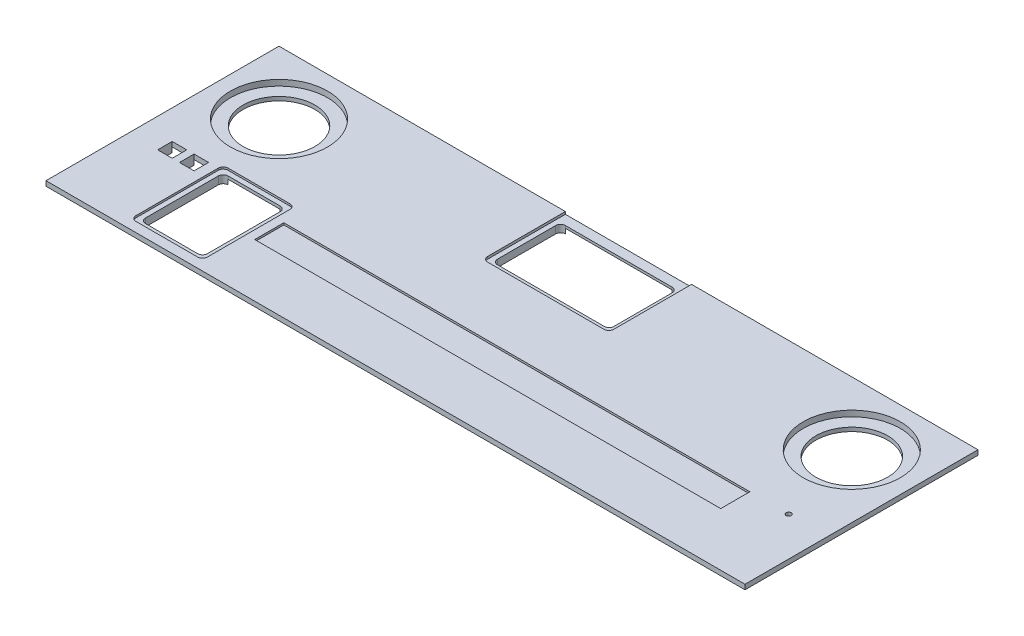
from build123d import *

# Parameters (mm, degrees)
SKETCH1_W           = 914.4
SKETCH1_H           = 304.8
BOSS_EXTRUDE1_DEPTH = 12.7
SKETCH5_W           = 609.6
SKETCH5_H           = 38.1
CUT_EXTRUDE3_DEPTH  = 2.54
SKETCH6_R           = 46.99
CUT_EXTRUDE4_DEPTH  = 964.945895785
SKETCH7_R           = 63.5
CUT_EXTRUDE5_DEPTH  = 7.62
CUT_EXTRUDE6_DEPTH  = 964.945895785
CUT_EXTRUDE7_DEPTH  = 3.175
SKETCH13_W          = 19.05
SKETCH13_H          = 19.05
CUT_EXTRUDE11_DEPTH = 964.945895785
CUT_EXTRUDE19_DEPTH = 964.945895785
CUT_EXTRUDE20_DEPTH = 2.54
SKETCH26_R          = 3.302
CUT_EXTRUDE21_DEPTH = 964.945895785
SKETCH19_W          = 914.4
SKETCH19_H          = 304.8
CUT_EXTRUDE16_DEPTH = 6.35


with BuildPart() as part:
    # Sketch1 → Boss-Extrude1 (new body)
    with BuildSketch(Plane(origin=(0, 0, 0), x_dir=(1, 0, 0), z_dir=(0, 1, 0))):
        with Locations((457.2, 152.4)):
            Rectangle(SKETCH1_W, SKETCH1_H)
    extrude(amount=BOSS_EXTRUDE1_DEPTH)

    # Sketch5 → Cut-Extrude3 (cut)
    with BuildSketch(Plane(origin=(0, 12.7, 0), x_dir=(1, 0, 0), z_dir=(0, 1, 0))):
        with Locations((508, 88.9)):
            Rectangle(SKETCH5_W, SKETCH5_H)
    extrude(amount=-CUT_EXTRUDE3_DEPTH, mode=Mode.SUBTRACT)

    # Sketch6 → Cut-Extrude4 (cut, through all)
    with BuildSketch(Plane(origin=(0, 12.7, 0), x_dir=(1, 0, 0), z_dir=(0, 1, 0))):
        with Locations((82.55, 222.25)):
            Circle(SKETCH6_R)
        with Locations((831.85, 222.25)):
            Circle(SKETCH6_R)
    extrude(amount=-CUT_EXTRUDE4_DEPTH, mode=Mode.SUBTRACT)

    # Sketch7 → Cut-Extrude5 (cut)
    with BuildSketch(Plane(origin=(0, 12.7, 0), x_dir=(1, 0, 0), z_dir=(0, 1, 0))):
        with Locations((82.55, 222.25)):
            Circle(SKETCH7_R)
        with Locations((831.85, 222.25)):
            Circle(SKETCH7_R)
    extrude(amount=-CUT_EXTRUDE5_DEPTH, mode=Mode.SUBTRACT)

    # Sketch8 → Cut-Extrude6 (cut, through all)
    with BuildSketch(Plane(origin=(0, 12.7, 0), x_dir=(1, 0, 0), z_dir=(0, 1, 0))):
        with BuildLine():
            Line((381, 285.75), (381, 209.55))
            ThreePointArc((381, 209.55), (382.859871939, 205.059871939), (387.35, 203.2))
            Line((387.35, 203.2), (527.05, 203.2))
            ThreePointArc((527.05, 203.2), (531.540128061, 205.059871939), (533.4, 209.55))
            Line((533.4, 209.55), (533.4, 285.75))
            ThreePointArc((533.4, 285.75), (531.540128061, 290.240128061), (527.05, 292.1))
            Line((527.05, 292.1), (387.35, 292.1))
            ThreePointArc((387.35, 292.1), (382.859871939, 290.240128061), (381, 285.75))
        make_face()
    extrude(amount=-CUT_EXTRUDE6_DEPTH, mode=Mode.SUBTRACT)

    # Sketch9 → Cut-Extrude7 (cut)
    with BuildSketch(Plane(origin=(0, 12.7, 0), x_dir=(1, 0, 0), z_dir=(0, 1, 0))):
        with BuildLine():
            Line((539.75, 304.8), (374.65, 304.8))
            Line((374.65, 304.8), (374.65, 202.946))
            ThreePointArc((374.65, 202.946), (376.509871939, 198.455871939), (381, 196.596))
            Line((381, 196.596), (533.4, 196.596))
            ThreePointArc((533.4, 196.596), (537.890128061, 198.455871939), (539.75, 202.946))
            Line((539.75, 202.946), (539.75, 304.8))
        make_face()
    extrude(amount=-CUT_EXTRUDE7_DEPTH, mode=Mode.SUBTRACT)

    # Sketch13 → Cut-Extrude11 (cut, through all)
    with BuildSketch(Plane(origin=(0, 12.7, 0), x_dir=(1, 0, 0), z_dir=(0, 1, 0))):
        with Locations((47.625, 117.475)):
            Rectangle(SKETCH13_W, SKETCH13_H)
        with Locations((76.2, 117.475)):
            Rectangle(SKETCH13_W, SKETCH13_H)
    extrude(amount=-CUT_EXTRUDE11_DEPTH, mode=Mode.SUBTRACT)

    # Sketch24 → Cut-Extrude19 (cut, through all)
    with BuildSketch(Plane(origin=(0, 12.7, 0), x_dir=(1, 0, 0), z_dir=(0, 1, 0))):
        with BuildLine():
            Line((111.125, 127), (179.3875, 127))
            ThreePointArc((179.3875, 127), (183.877628061, 125.140128061), (185.7375, 120.65))
            Line((185.7375, 120.65), (185.7375, 25.4))
            ThreePointArc((185.7375, 25.4), (183.877628061, 20.909871939), (179.3875, 19.05))
            Line((179.3875, 19.05), (111.125, 19.05))
            ThreePointArc((111.125, 19.05), (106.634871939, 20.909871939), (104.775, 25.4))
            Line((104.775, 25.4), (104.775, 120.65))
            ThreePointArc((104.775, 120.65), (106.634871939, 125.140128061), (111.125, 127))
        make_face()
    extrude(amount=-CUT_EXTRUDE19_DEPTH, mode=Mode.SUBTRACT)

    # Sketch25 → Cut-Extrude20 (cut)
    with BuildSketch(Plane(origin=(0, 12.7, 0), x_dir=(1, 0, 0), z_dir=(0, 1, 0))):
        with BuildLine():
            Line((104.775, 133.35), (185.7375, 133.35))
            ThreePointArc((185.7375, 133.35), (190.227628061, 131.490128061), (192.0875, 127))
            Line((192.0875, 127), (192.0875, 19.05))
            ThreePointArc((192.0875, 19.05), (190.227628061, 14.559871939), (185.7375, 12.7))
            Line((185.7375, 12.7), (104.775, 12.7))
            ThreePointArc((104.775, 12.7), (100.284871939, 14.559871939), (98.425, 19.05))
            Line((98.425, 19.05), (98.425, 127))
            ThreePointArc((98.425, 127), (100.284871939, 131.490128061), (104.775, 133.35))
        make_face()
    extrude(amount=-CUT_EXTRUDE20_DEPTH, mode=Mode.SUBTRACT)

    # Sketch26 → Cut-Extrude21 (cut, through all)
    with BuildSketch(Plane(origin=(0, 12.7, 0), x_dir=(1, 0, 0), z_dir=(0, 1, 0))):
        with Locations((863.6, 107.95)):
            Circle(SKETCH26_R)
    extrude(amount=-CUT_EXTRUDE21_DEPTH, mode=Mode.SUBTRACT)

    # Sketch19 → Cut-Extrude16 (cut)
    with BuildSketch(Plane.XZ):
        with Locations((457.2, -152.4)):
            Rectangle(SKETCH19_W, SKETCH19_H)
        with BuildLine():
            Line((12.7, -292.1), (12.7, -139.7))
            Line((12.7, -139.7), (311.15, -139.7))
            ThreePointArc((311.15, -139.7), (315.640128061, -141.559871939), (317.5, -146.05))
            Line((317.5, -146.05), (317.5, -292.1))
            Line((317.5, -292.1), (12.7, -292.1))
        make_face(mode=Mode.SUBTRACT)
        with BuildLine():
            Line((901.7, -292.1), (596.9, -292.1))
            Line((596.9, -292.1), (596.9, -146.05))
            ThreePointArc((596.9, -146.05), (598.759871939, -141.559871939), (603.25, -139.7))
            Line((603.25, -139.7), (901.7, -139.7))
            Line((901.7, -139.7), (901.7, -292.1))
        make_face(mode=Mode.SUBTRACT)
        with BuildLine():
            Line((38.1, -127), (12.7, -127))
            Line((12.7, -127), (12.7, -12.7))
            Line((12.7, -12.7), (901.7, -12.7))
            Line((901.7, -12.7), (901.7, -127))
            Line((901.7, -127), (590.55, -127))
            ThreePointArc((590.55, -127), (586.059871939, -128.859871939), (584.2, -133.35))
            Line((584.2, -133.35), (584.2, -292.1))
            Line((584.2, -292.1), (527.05, -292.1))
            Line((527.05, -292.1), (387.35, -292.1))
            Line((387.35, -292.1), (330.2, -292.1))
            Line((330.2, -292.1), (330.2, -133.35))
            ThreePointArc((330.2, -133.35), (328.340128061, -128.859871939), (323.85, -127))
            Line((323.85, -127), (85.725, -127))
            Line((85.725, -127), (66.675, -127))
            Line((66.675, -127), (57.15, -127))
            Line((57.15, -127), (38.1, -127))
        make_face(mode=Mode.SUBTRACT)
    extrude(amount=-CUT_EXTRUDE16_DEPTH, mode=Mode.SUBTRACT)


solid = part.part
